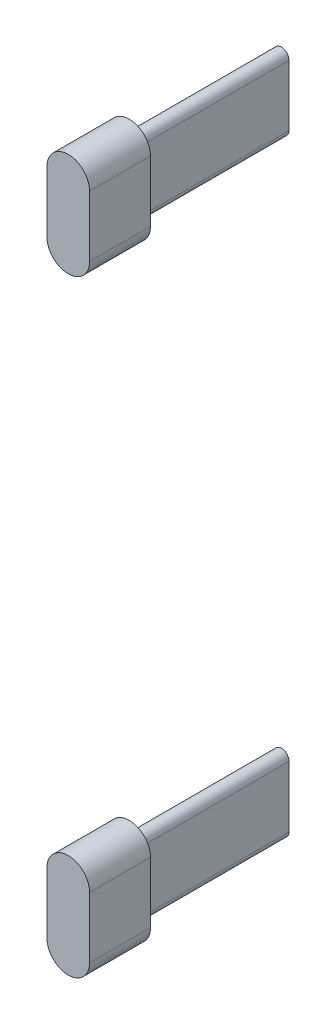
from build123d import *

# Parameters (mm, degrees)
EXTRUDE_1_DEPTH   = 20
EXTRUDE_1_2_DEPTH = 20
EXTRUDE_2_DEPTH   = 8


with BuildPart() as part:
    # 草图1 → 凸台-拉伸1 (new body)
    with BuildSketch(Plane.XY):
        with BuildLine():
            Line((-4.353218026, -34.118509408), (-4.353218026, -26.118509408))
            ThreePointArc((-4.353218026, -26.118509408), (-5.353218026, -25.118509408), (-6.353218026, -26.118509408))
            Line((-6.353218026, -26.118509408), (-6.353218026, -34.118509408))
            ThreePointArc((-6.353218026, -34.118509408), (-5.353218026, -35.118509408), (-4.353218026, -34.118509408))
        make_face()
    extrude(amount=-EXTRUDE_1_DEPTH)



with BuildPart() as body_2:
    # 草图1 → Extrude 1 2 (new body)
    with BuildSketch(Plane.XY):
        with BuildLine():
            Line((-4.353218026, -113.881490592), (-4.353218026, -105.881490592))
            ThreePointArc((-4.353218026, -105.881490592), (-5.353218026, -104.881490592), (-6.353218026, -105.881490592))
            Line((-6.353218026, -105.881490592), (-6.353218026, -113.881490592))
            ThreePointArc((-6.353218026, -113.881490592), (-5.353218026, -114.881490592), (-4.353218026, -113.881490592))
        make_face()
    extrude(amount=-EXTRUDE_1_2_DEPTH)


with BuildPart() as part_1:
    add(part.part)

    add(body_2.part)  # 凸台-拉伸2 merges body 2
    # 草图2 → 凸台-拉伸2 (add)
    with BuildSketch(Plane.XY):
        with BuildLine():
            Line((-8.153218026, -105.881490592), (-8.153218026, -113.881490592))
            ThreePointArc((-8.153218026, -113.881490592), (-5.353218026, -116.681490592), (-2.553218026, -113.881490592))
            Line((-2.553218026, -113.881490592), (-2.553218026, -105.881490592))
            ThreePointArc((-2.553218026, -105.881490592), (-5.353218026, -103.081490592), (-8.153218026, -105.881490592))
        make_face()
        with BuildLine():
            Line((-8.153218026, -26.118509408), (-8.153218026, -34.118509408))
            ThreePointArc((-8.153218026, -34.118509408), (-5.353218026, -36.918509408), (-2.553218026, -34.118509408))
            Line((-2.553218026, -34.118509408), (-2.553218026, -26.118509408))
            ThreePointArc((-2.553218026, -26.118509408), (-5.353218026, -23.318509408), (-8.153218026, -26.118509408))
        make_face()
    extrude(amount=EXTRUDE_2_DEPTH)


solid = part_1.part
